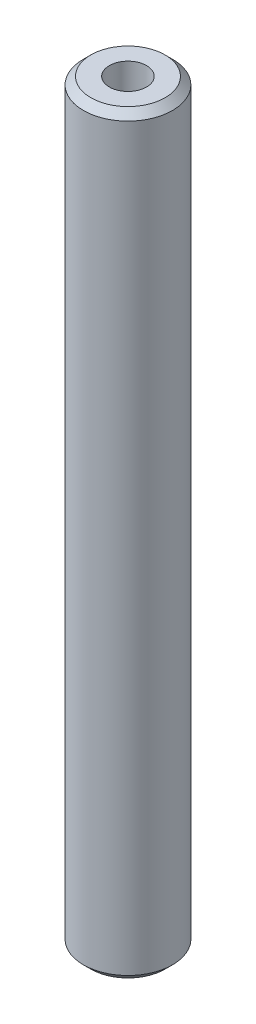
from build123d import *

# Parameters (mm, degrees)
SKETCH1_R           = 7.5
BOSS_EXTRUDE1_DEPTH = 127.177910124
SKETCH2_R           = 3.134121222
CUT_EXTRUDE1_DEPTH  = 128.619437483
CHAMFER1_SIZE       = 1.242939927


with BuildPart() as part:
    # Sketch1 → Boss-Extrude1 (new body)
    with BuildSketch(Plane(origin=(0, 0, 0), x_dir=(1, 0, 0), z_dir=(0, 1, 0))):
        Circle(SKETCH1_R)
    extrude(amount=BOSS_EXTRUDE1_DEPTH)

    # Sketch2 → Cut-Extrude1 (cut, through all)
    with BuildSketch(Plane(origin=(0, 0, 0), x_dir=(1, 0, 0), z_dir=(0, 1, 0))):
        Circle(SKETCH2_R)
    extrude(amount=CUT_EXTRUDE1_DEPTH, mode=Mode.SUBTRACT)

    # Chamfer1
    chamfer1_edges = [part.edges().sort_by_distance(p)[0] for p in [
        (-7.5, 127.177910124, 0),
        (-7.5, 0, 0),
    ]]
    chamfer(chamfer1_edges, length=CHAMFER1_SIZE)


solid = part.part
